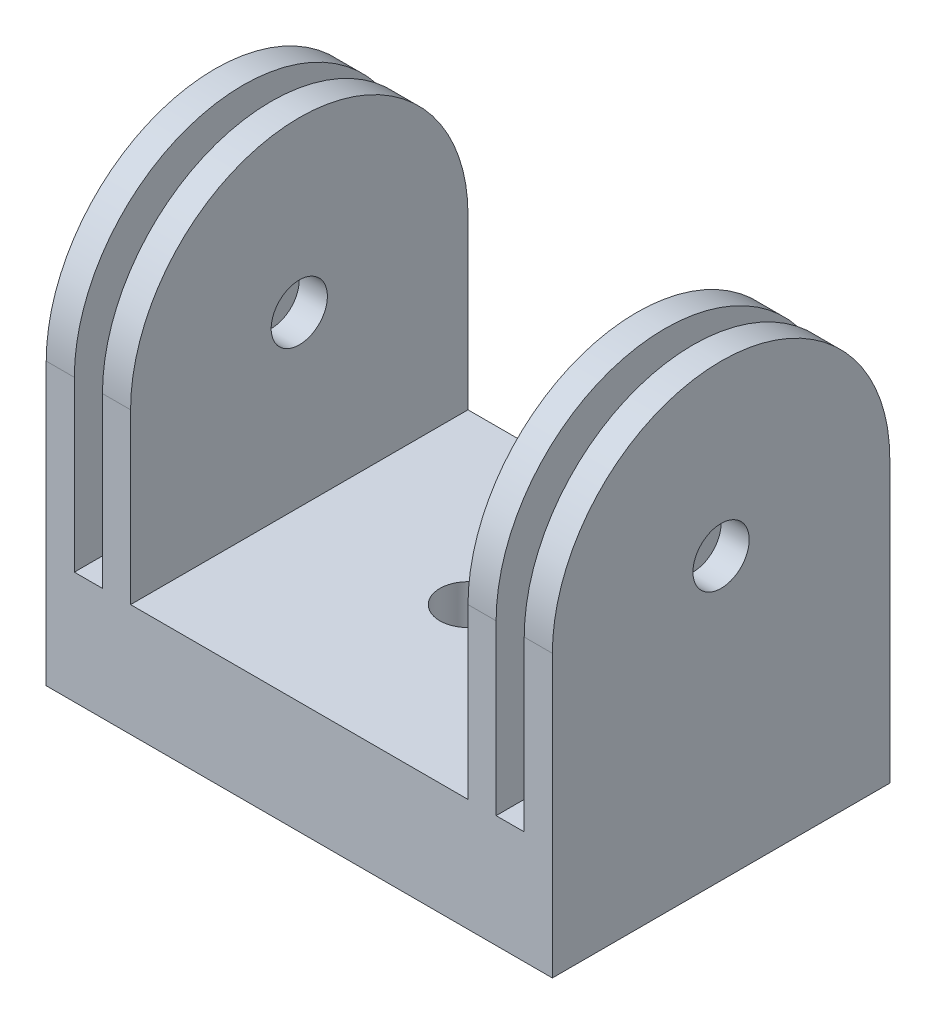
from build123d import *

# Parameters (mm, degrees)
SKETCH1_W               = 45
SKETCH1_H               = 30
SKETCH1_R               = 2.5
BOSS_EXTRUDE1_DEPTH     = 10
SKETCH2_R               = 2.5
BOSS_EXTRUDE2_DEPTH     = 2.5
MIRROR3_COPY_1_SKETCH_R = 2.5
MIRROR3_COPY_1_DEPTH    = 2.5
MIRROR3_COPY_2_SKETCH_R = 2.5
MIRROR3_COPY_2_DEPTH    = 2.5


with BuildPart() as part:
    # Sketch1 → Boss-Extrude1 (new body)
    with BuildSketch(Plane(origin=(0, 0, 0), x_dir=(1, 0, 0), z_dir=(0, 1, 0))):
        Rectangle(SKETCH1_W, SKETCH1_H)
        Circle(SKETCH1_R, mode=Mode.SUBTRACT)
    extrude(amount=BOSS_EXTRUDE1_DEPTH)

    # Sketch2 → Boss-Extrude2 (add)
    with BuildSketch(Plane(origin=(22.5, 0, 0), x_dir=(0, 0, -1), z_dir=(1, 0, 0))):
        with BuildLine():
            Line((-15, 10), (15, 10))
            Line((15, 10), (15, 25))
            ThreePointArc((15, 25), (0, 40), (-15, 25))
            Line((-15, 25), (-15, 10))
        make_face()
        with Locations((0, 25)):
            Circle(SKETCH2_R, mode=Mode.SUBTRACT)
    boss_extrude2 = extrude(amount=-BOSS_EXTRUDE2_DEPTH)

    # Mirror2: Boss-Extrude2 across plane
    add(boss_extrude2.mirror(Plane(origin=(18.75, 0, 0), x_dir=(0, 0, 1), z_dir=(1, 0, 0))))

    # Mirror3 copy 1 sketch → Mirror3 copy 1 (add)
    with BuildSketch(Plane(origin=(-15, 0, 0), x_dir=(0, 0, -1), z_dir=(1, 0, 0))):
        with BuildLine():
            Line((-15, 10), (15, 10))
            Line((15, 10), (15, 25))
            ThreePointArc((15, 25), (0, 40), (-15, 25))
            Line((-15, 25), (-15, 10))
        make_face()
        with Locations((0, 25)):
            Circle(MIRROR3_COPY_1_SKETCH_R, mode=Mode.SUBTRACT)
    extrude(amount=-MIRROR3_COPY_1_DEPTH)

    # Mirror3 copy 2 sketch → Mirror3 copy 2 (add)
    with BuildSketch(Plane(origin=(-22.5, 0, 0), x_dir=(0, 0, -1), z_dir=(-1, 0, 0))):
        with BuildLine():
            Line((-15, -10), (15, -10))
            Line((15, -10), (15, -25))
            ThreePointArc((15, -25), (0, -40), (-15, -25))
            Line((-15, -25), (-15, -10))
        make_face()
        with Locations((0, -25)):
            Circle(MIRROR3_COPY_2_SKETCH_R, mode=Mode.SUBTRACT)
    extrude(amount=-MIRROR3_COPY_2_DEPTH)


solid = part.part
